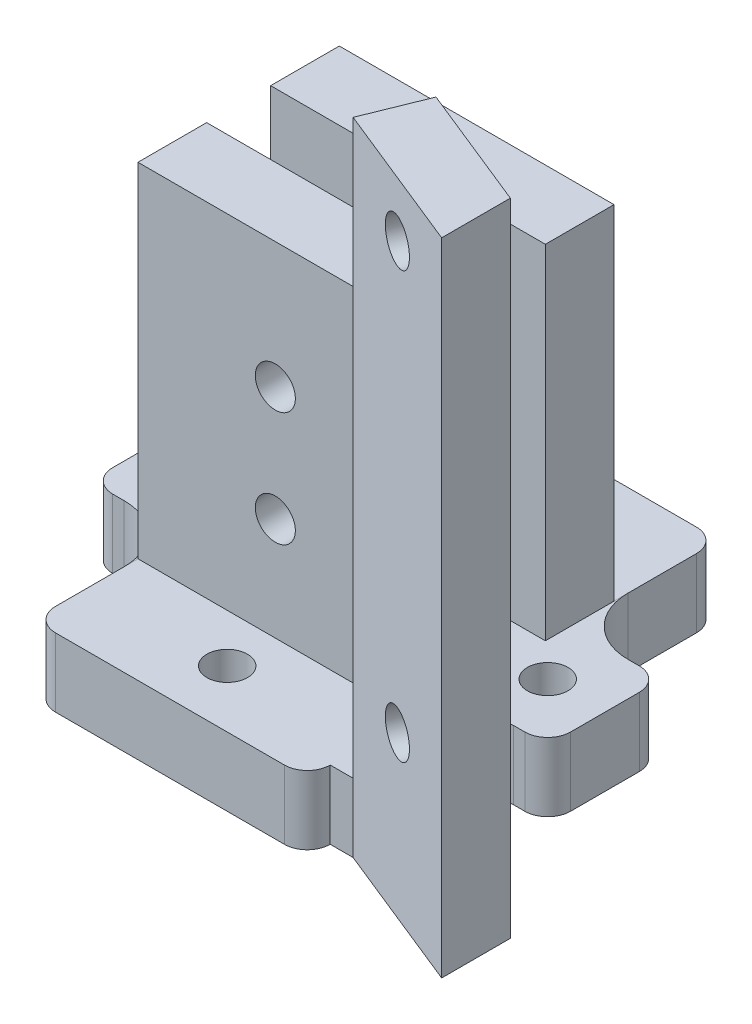
from build123d import *

# Parameters (mm, degrees)
SKETCH1_W           = 24
SKETCH1_H           = 24
BOSS_EXTRUDE1_DEPTH = 6
SKETCH2_W           = 24
SKETCH2_H           = 6
BOSS_EXTRUDE2_DEPTH = 30
SKETCH3_W           = 24
SKETCH3_H           = 6
BOSS_EXTRUDE3_DEPTH = 6
SKETCH4_W           = 24
SKETCH4_H           = 6
BOSS_EXTRUDE4_DEPTH = 6
SKETCH5_W           = 10
SKETCH5_H           = 6
BOSS_EXTRUDE5_DEPTH = 8
FILLET1_R           = 5
FILLET2_R           = 2
FILLET3_R           = 2
SKETCH6_W           = 10
SKETCH6_H           = 6
BOSS_EXTRUDE6_DEPTH = 8
FILLET4_R           = 5
FILLET5_R           = 2
SKETCH7_R           = 1.775
CUT_EXTRUDE1_DEPTH  = 42.568724431
SKETCH8_W           = 6
SKETCH8_H           = 6
BOSS_EXTRUDE7_DEPTH = 2
SKETCH10_W          = 6
SKETCH10_H          = 6
BOSS_EXTRUDE8_DEPTH = 14
BOSS_EXTRUDE9_DEPTH = 50
SKETCH12_R          = 1.905
CUT_EXTRUDE2_DEPTH  = 70.795111418
CUT_EXTRUDE3_REACH  = 70.468
SKETCH13_R          = 1.75


with BuildPart() as part:
    # Sketch1 → Boss-Extrude1 (new body)
    with BuildSketch(Plane(origin=(0, 0, 0), x_dir=(1, 0, 0), z_dir=(0, 1, 0))):
        with Locations((1.896724894, -0.667948192)):
            Rectangle(SKETCH1_W, SKETCH1_H)
    extrude(amount=BOSS_EXTRUDE1_DEPTH)

    # Sketch2 → Boss-Extrude2 (add)
    with BuildSketch(Plane(origin=(0, 6, 0), x_dir=(1, 0, 0), z_dir=(0, 1, 0))):
        with Locations((1.896724894, -6.462948192)):
            Rectangle(SKETCH2_W, SKETCH2_H)
        with Locations((1.896724894, 5.127051808)):
            Rectangle(SKETCH2_W, SKETCH2_H)
    extrude(amount=BOSS_EXTRUDE2_DEPTH)

    # Sketch3 → Boss-Extrude3 (add)
    with BuildSketch(Plane.XY.offset(12.667948192)):
        with Locations((1.896724894, 3)):
            Rectangle(SKETCH3_W, SKETCH3_H)
    extrude(amount=BOSS_EXTRUDE3_DEPTH)

    # Sketch4 → Boss-Extrude4 (add)
    with BuildSketch(Plane(origin=(0, 0, -11.332051808), x_dir=(-1, 0, 0), z_dir=(0, 0, -1))):
        with Locations((-1.896724894, 3)):
            Rectangle(SKETCH4_W, SKETCH4_H)
    extrude(amount=BOSS_EXTRUDE4_DEPTH)

    # Sketch5 → Boss-Extrude5 (add)
    with BuildSketch(Plane(origin=(13.896724894, 0, 0), x_dir=(0, 0, -1), z_dir=(1, 0, 0))):
        with Locations((-0.667948192, 3)):
            Rectangle(SKETCH5_W, SKETCH5_H)
    extrude(amount=BOSS_EXTRUDE5_DEPTH)

    # Fillet1
    # the kernel refuses this fillet: 5 mm, written as the material it adds along each edge
    with BuildSketch(Plane(origin=(13.896724894, 0, -4.332051808), x_dir=(0, 0, -1), z_dir=(0, 1, 0)), Plane(origin=(13.896724894, 6, 5.667948192), x_dir=(0, 0, 1), z_dir=(0, -1, 0))) as fillet1_piece_1:
        with BuildLine():
            CenterArc((FILLET1_R, -FILLET1_R), FILLET1_R, 90, 90)
            Line((0, -FILLET1_R), (0, 0))
            Line((0, 0), (FILLET1_R, 0))
        make_face()
    extrude(amount=6)

    # Fillet2
    fillet2_edges = [part.edges().sort_by_distance(p)[0] for p in [
        (21.896724894, 3, -4.332051808),
        (21.896724894, 3, 5.667948192),
    ]]
    fillet(fillet2_edges, radius=FILLET2_R)

    # Fillet3
    fillet3_edges = [part.edges().sort_by_distance(p)[0] for p in [
        (-10.103275106, 3, 18.667948192),
        (13.896724894, 3, 18.667948192),
        (13.896724894, 3, -17.332051808),
        (-10.103275106, 3, -17.332051808),
    ]]
    fillet(fillet3_edges, radius=FILLET3_R)

    # Sketch6 → Boss-Extrude6 (add)
    with BuildSketch(Plane.ZY.offset(10.103275106)):
        with Locations((0.667948192, 3)):
            Rectangle(SKETCH6_W, SKETCH6_H)
    extrude(amount=BOSS_EXTRUDE6_DEPTH)

    # Fillet4
    # the kernel refuses this fillet: 5 mm, written as the material it adds along each edge
    with BuildSketch(Plane(origin=(-10.103275106, 6, -4.332051808), x_dir=(0, 0, -1), z_dir=(0, -1, 0)), Plane(origin=(-10.103275106, 0, 5.667948192), x_dir=(0, 0, 1), z_dir=(0, 1, 0))) as fillet4_piece_1:
        with BuildLine():
            CenterArc((FILLET4_R, -FILLET4_R), FILLET4_R, 90, 90)
            Line((0, -FILLET4_R), (0, 0))
            Line((0, 0), (FILLET4_R, 0))
        make_face()
    extrude(amount=6)

    # Fillet5
    fillet5_edges = [part.edges().sort_by_distance(p)[0] for p in [
        (-18.103275106, 3, -4.332051808),
        (-18.103275106, 3, 5.667948192),
    ]]
    fillet(fillet5_edges, radius=FILLET5_R)

    # Sketch7 → Cut-Extrude1 (cut, through all)
    with BuildSketch(Plane(origin=(0, 6, 0), x_dir=(1, 0, 0), z_dir=(0, 1, 0))):
        with Locations(Location((1.896724894, -13.667948192, 0), (0, 0, 270))):
            Circle(SKETCH7_R)
        with Locations(Location((-13.103275106, -0.667948192, 0), (0, 0, 270))):
            Circle(SKETCH7_R)
        with Locations(Location((1.896724894, 12.332051808, 0), (0, 0, 270))):
            Circle(SKETCH7_R)
        with Locations(Location((16.896724894, -0.667948192, 0), (0, 0, 270))):
            Circle(SKETCH7_R)
    extrude(amount=-CUT_EXTRUDE1_DEPTH, mode=Mode.SUBTRACT)

    # Sketch8 → Boss-Extrude7 (add)
    with BuildSketch(Plane(origin=(13.896724894, 0, 0), x_dir=(0, 0, -1), z_dir=(1, 0, 0))):
        with Locations((-13.667948192, 3)):
            Rectangle(SKETCH8_W, SKETCH8_H)
    extrude(amount=BOSS_EXTRUDE7_DEPTH)

    # Sketch10 → Boss-Extrude8 (add, along a direction that is not the sketch's normal)
    with BuildSketch(Plane(origin=(15.896724894, 0, 0), x_dir=(0, 0, -1), z_dir=(1, 0, 0))):
        with Locations((-13.667948192, 3)):
            Rectangle(SKETCH10_W, SKETCH10_H)
    extrude(amount=BOSS_EXTRUDE8_DEPTH, dir=(0.9271838545667885, 0, 0.3746065934159094))

    # Sketch11 → Boss-Extrude9 (add)
    with BuildSketch(Plane(origin=(0, 6, 0), x_dir=(1, 0, 0), z_dir=(0, 1, 0))):
        Polygon((28.877298858, -21.9124405), (15.896724894, -16.667948192), (17.980700006, -11.509928791), (28.877298858, -15.9124405), align=None)
    extrude(amount=BOSS_EXTRUDE9_DEPTH)

    # Sketch12 → Cut-Extrude2 (cut, through all)
    with BuildSketch(Plane(origin=(-3.558475874, 0, 8.807536853), x_dir=(0.9271838545667885, 0, 0.3746065934159093), z_dir=(-0.37460659341590935, 0, 0.9271838545667886))):
        with Locations((27.983109954, 14)):
            Circle(SKETCH12_R)
        with Locations((27.983109954, 51.211)):
            Circle(SKETCH12_R)
    extrude(amount=-CUT_EXTRUDE2_DEPTH, mode=Mode.SUBTRACT)

    # Cut-Extrude3: up to this face of the body (flat: up to its plane)
    cut_extrude3_end = Plane(part.part.faces().sort_by_distance((1.896724894, 21, -8.127051808))[0])
    # Sketch13 → Cut-Extrude3 (cut, up to the picked face)
    with BuildSketch(Plane.XY.offset(9.462948192), mode=Mode.PRIVATE) as cut_extrude3_sk1:
        with Locations((1.896724894, 15)):
            Circle(SKETCH13_R)
    cut_extrude3_tool1 = split(extrude(cut_extrude3_sk1.sketch, amount=-CUT_EXTRUDE3_REACH, mode=Mode.PRIVATE), bisect_by=cut_extrude3_end, keep=Keep.BOTH, mode=Mode.PRIVATE)
    # Sketch13 → Cut-Extrude3 (cut, up to the picked face)
    with BuildSketch(Plane.XY.offset(9.462948192), mode=Mode.PRIVATE) as cut_extrude3_sk2:
        with Locations((1.896724894, 25)):
            Circle(SKETCH13_R)
    cut_extrude3_tool2 = split(extrude(cut_extrude3_sk2.sketch, amount=-CUT_EXTRUDE3_REACH, mode=Mode.PRIVATE), bisect_by=cut_extrude3_end, keep=Keep.BOTH, mode=Mode.PRIVATE)
    add(cut_extrude3_tool1.solids().sort_by(Axis((1.896725, 15, 9.462948), (0, 0, -1)))[0], mode=Mode.SUBTRACT)
    add(cut_extrude3_tool2.solids().sort_by(Axis((1.896725, 25, 9.462948), (0, 0, -1)))[0], mode=Mode.SUBTRACT)


solid = part.part
